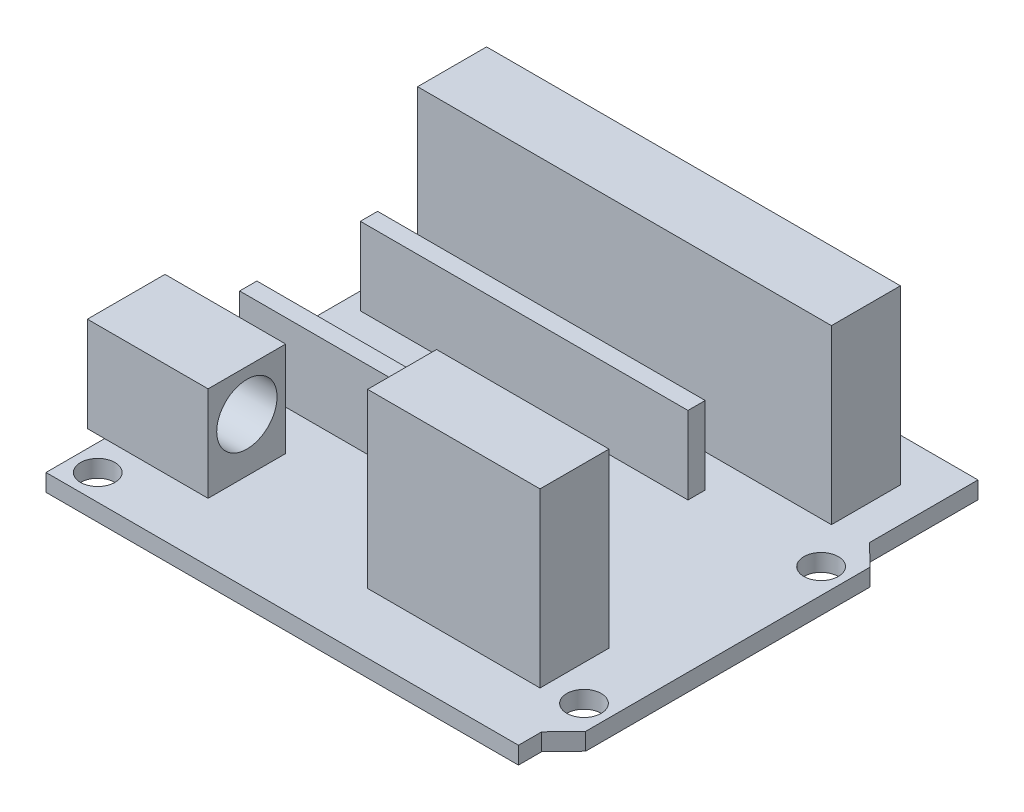
from build123d import *

# Parameters (mm, degrees)
SKETCH1_R           = 2
BOSS_EXTRUDE1_DEPTH = 2
SKETCH2_W           = 38
SKETCH2_H           = 2
BOSS_EXTRUDE2_DEPTH = 9
LPATTERN1_COUNT     = 2
LPATTERN1_PITCH     = 14
SKETCH3_W           = 20
SKETCH3_H           = 8
BOSS_EXTRUDE3_DEPTH = 20
SKETCH4_W           = 48
SKETCH4_H           = 8
BOSS_EXTRUDE4_DEPTH = 20
SKETCH5_W           = 9
SKETCH5_H           = 11
SKETCH5_R           = 3.5
BOSS_EXTRUDE5_DEPTH = 14
SKETCH6_R           = 0.5
BOSS_EXTRUDE6_DEPTH = 2.2
LPATTERN2_COUNT     = 2
LPATTERN2_PITCH     = 5
LPATTERN3_COUNT     = 2
LPATTERN3_PITCH     = 5


with BuildPart() as part:
    # Sketch1 → Boss-Extrude1 (new body)
    with BuildSketch(Plane(origin=(0, 0, 0), x_dir=(1, 0, 0), z_dir=(0, 1, 0))):
        Polygon((54.8, 40.7), (54.8, 53.3), (0, 53.3), (0, 0), (54.8, 0), (54.8, 2.695833333), (57.3, 5.3), (57.3, 38.3), align=None)
        with Locations((3, 3)):
            Circle(SKETCH1_R, mode=Mode.SUBTRACT)
        with Locations((54.4, 8)):
            Circle(SKETCH1_R, mode=Mode.SUBTRACT)
        with Locations((4, 50.8)):
            Circle(SKETCH1_R, mode=Mode.SUBTRACT)
        with Locations((54.4, 35.5)):
            Circle(SKETCH1_R, mode=Mode.SUBTRACT)
    extrude(amount=BOSS_EXTRUDE1_DEPTH)

    # Sketch2 → Boss-Extrude2 (add)
    with BuildSketch(Plane(origin=(0, 2, 0), x_dir=(1, 0, 0), z_dir=(0, 1, 0))):
        with Locations((21, 35.460185898)):
            Rectangle(SKETCH2_W, SKETCH2_H)
    boss_extrude2 = extrude(amount=BOSS_EXTRUDE2_DEPTH)

    # LPattern1: Boss-Extrude2 ×2
    with Locations(*[(0, 0, i * LPATTERN1_PITCH) for i in range(1, LPATTERN1_COUNT)]):
        add(boss_extrude2)

    # Sketch3 → Boss-Extrude3 (add)
    with BuildSketch(Plane(origin=(0, 2, 0), x_dir=(1, 0, 0), z_dir=(0, 1, 0))):
        with Locations((40.3, 11)):
            Rectangle(SKETCH3_W, SKETCH3_H)
    extrude(amount=BOSS_EXTRUDE3_DEPTH)

    # Sketch4 → Boss-Extrude4 (add)
    with BuildSketch(Plane(origin=(0, 2, 0), x_dir=(1, 0, 0), z_dir=(0, 1, 0))):
        with Locations((26.8, 44.3)):
            Rectangle(SKETCH4_W, SKETCH4_H)
    extrude(amount=BOSS_EXTRUDE4_DEPTH)

    # Sketch5 → Boss-Extrude5 (add)
    with BuildSketch(Plane.ZY.offset(2)):
        with Locations((-11.3, 7.5)):
            Rectangle(SKETCH5_W, SKETCH5_H)
        with Locations((-11.3, 8.2)):
            Circle(SKETCH5_R, mode=Mode.SUBTRACT)
    extrude(amount=-BOSS_EXTRUDE5_DEPTH)

    # Sketch6 → Boss-Extrude6 (add)
    with BuildSketch(Plane.XZ):
        with Locations((6.488337658, -7.768048355)):
            Circle(SKETCH6_R)
    boss_extrude6 = extrude(amount=BOSS_EXTRUDE6_DEPTH)

    # LPattern2: Boss-Extrude6 ×2
    with Locations(*[Vector(0.9316516014644738, 0, -0.36335284984252075) * (i * LPATTERN2_PITCH) for i in range(1, LPATTERN2_COUNT)]):
        add(boss_extrude6)

    # LPattern3: Boss-Extrude6 ×2
    with Locations(*[(0, 0, -i * LPATTERN3_PITCH) for i in range(1, LPATTERN3_COUNT)]):
        add(boss_extrude6)


solid = part.part
